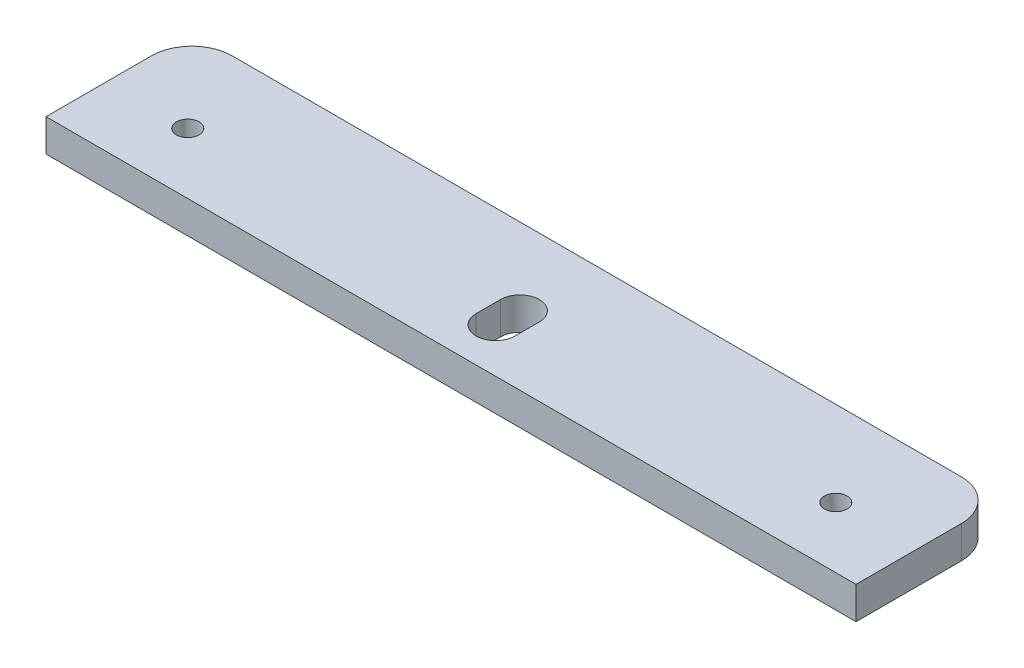
from build123d import *

# Parameters (mm, degrees)
SKETCH1_W              = 63.5
SKETCH1_H              = 22.86
PLATE_DEPTH            = 5.08
FILLET1_R              = 6.35
MONITORSCREWHOLE_DEPTH = 68.68039598
SKETCH3_R              = 1.778
F_8_32TAPHOLES_DEPTH   = 68.68039598
FILLET1_OF_MIRROR1_R   = 6.35


with BuildPart() as part:
    # Sketch1 → Plate (new body)
    with BuildSketch(Plane(origin=(0, 0, 0), x_dir=(1, 0, 0), z_dir=(0, 1, 0))):
        with Locations((-31.75, 11.43)):
            Rectangle(SKETCH1_W, SKETCH1_H)
    plate = extrude(amount=PLATE_DEPTH)

    # Fillet1
    fillet1_edges = [part.edges().sort_by_distance(p)[0] for p in [
        (-63.5, 2.54, -22.86),
    ]]
    fillet(fillet1_edges, radius=FILLET1_R)

    # Sketch2 → MonitorScrewHole (cut, through all)
    with BuildSketch(Plane(origin=(0, 5.08, 0), x_dir=(1, 0, 0), z_dir=(0, 1, 0))):
        with BuildLine():
            Line((3.048, 10.795), (3.048, 6.985))
            ThreePointArc((3.048, 6.985), (0, 3.937), (-3.048, 6.985))
            Line((-3.048, 6.985), (-3.048, 10.795))
            ThreePointArc((-3.048, 10.795), (0, 13.843), (3.048, 10.795))
        make_face()
    monitorscrewhole = extrude(amount=-MONITORSCREWHOLE_DEPTH, mode=Mode.SUBTRACT)

    # Sketch3 → 8-32TapHoles (cut, through all)
    with BuildSketch(Plane(origin=(0, 5.08, 0), x_dir=(1, 0, 0), z_dir=(0, 1, 0))):
        with Locations((-50.8, 9.525)):
            Circle(SKETCH3_R)
    f_8_32tapholes = extrude(amount=-F_8_32TAPHOLES_DEPTH, mode=Mode.SUBTRACT)

    # Mirror1: Plate, MonitorScrewHole, 8-32TapHoles across plane
    add(plate.mirror(Plane(origin=(0, 5.08, 0), x_dir=(0, 0, 1), z_dir=(-1, 0, 0))))
    add(monitorscrewhole.mirror(Plane(origin=(0, 5.08, 0), x_dir=(0, 0, 1), z_dir=(-1, 0, 0))), mode=Mode.SUBTRACT)
    add(f_8_32tapholes.mirror(Plane(origin=(0, 5.08, 0), x_dir=(0, 0, 1), z_dir=(-1, 0, 0))), mode=Mode.SUBTRACT)

    # Fillet1 of Mirror1
    fillet1_of_mirror1_edges = [part.edges().sort_by_distance(p)[0] for p in [
        (63.5, 2.54, -22.86),
    ]]
    fillet(fillet1_of_mirror1_edges, radius=FILLET1_OF_MIRROR1_R)


solid = part.part
